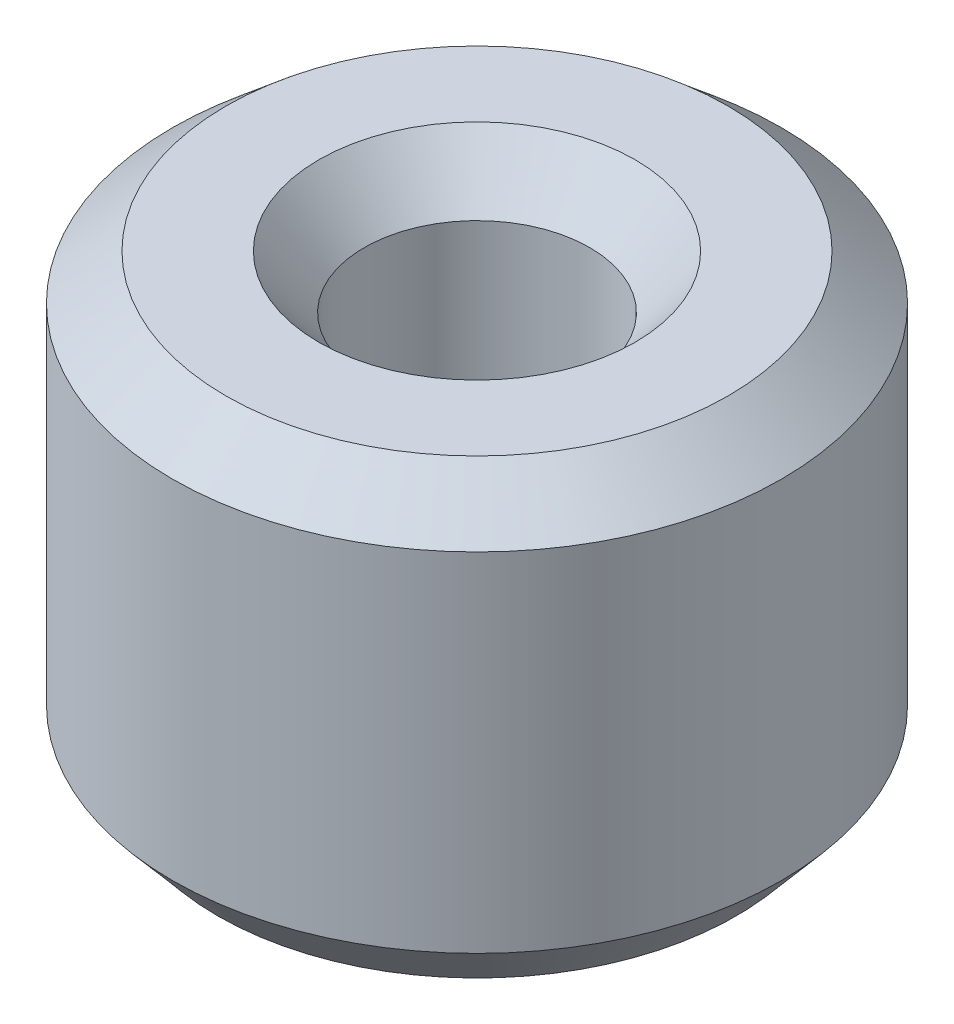
from build123d import *
from OCP.BRepFilletAPI import BRepFilletAPI_MakeChamfer

# Parameters (mm, degrees)
SKETCH1_R           = 12.5
BOSS_EXTRUDE1_DEPTH = 18.328211397
SKETCH2_R           = 4.629815426
CUT_EXTRUDE1_DEPTH  = 26.464157811
CHAMFER1_SIZE       = 1.862553043
CHAMFER1_SIZE2      = 2.192134217


with BuildPart() as part:
    # Sketch1 → Boss-Extrude1 (new body)
    with BuildSketch(Plane(origin=(0, 0, 0), x_dir=(1, 0, 0), z_dir=(0, 1, 0))):
        Circle(SKETCH1_R)
    extrude(amount=BOSS_EXTRUDE1_DEPTH)

    # Sketch2 → Cut-Extrude1 (cut, through all)
    with BuildSketch(Plane(origin=(0, 0, 0), x_dir=(1, 0, 0), z_dir=(0, 1, 0))):
        Circle(SKETCH2_R)
    extrude(amount=CUT_EXTRUDE1_DEPTH, mode=Mode.SUBTRACT)

    # Chamfer1: one chamfer whose edges measure the first distance from different faces: ONE call of the kernel's chamfer builder (chamfer() names one face for all edges)
    chamfer1_edges_1 = [part.edges().sort_by_distance(p)[0] for p in [
        (-4.629815426, 18.328211397, 0),
    ]]
    chamfer1_side_1 = [part.faces().sort_by_distance(p)[0] for p in [
        (-12.146446609, 18.328211397, 0),
    ]]
    chamfer1_edges_2 = [part.edges().sort_by_distance(p)[0] for p in [
        (-4.629815426, 0, 0),
    ]]
    chamfer1_side_2 = [part.faces().sort_by_distance(p)[0] for p in [
        (-4.629815426, 9.164105698, 0),
    ]]
    chamfer1_edges_3 = [part.edges().sort_by_distance(p)[0] for p in [
        (-12.5, 0, 0),
    ]]
    chamfer1_side_3 = [part.faces().sort_by_distance(p)[0] for p in [
        (-12.146446609, 0, 0),
    ]]
    chamfer1_edges_4 = [part.edges().sort_by_distance(p)[0] for p in [
        (-12.5, 18.328211397, 0),
    ]]
    chamfer1_side_4 = [part.faces().sort_by_distance(p)[0] for p in [
        (-12.5, 9.164105698, 0),
    ]]
    chamfer1 = BRepFilletAPI_MakeChamfer(part.part.solid().wrapped)
    for e in chamfer1_edges_1:
        chamfer1.Add(CHAMFER1_SIZE, CHAMFER1_SIZE2, e.wrapped, chamfer1_side_1[0].wrapped)  # the first distance lies on this face
    for e in chamfer1_edges_2:
        chamfer1.Add(CHAMFER1_SIZE, CHAMFER1_SIZE2, e.wrapped, chamfer1_side_2[0].wrapped)  # the first distance lies on this face
    for e in chamfer1_edges_3:
        chamfer1.Add(CHAMFER1_SIZE, CHAMFER1_SIZE2, e.wrapped, chamfer1_side_3[0].wrapped)  # the first distance lies on this face
    for e in chamfer1_edges_4:
        chamfer1.Add(CHAMFER1_SIZE, CHAMFER1_SIZE2, e.wrapped, chamfer1_side_4[0].wrapped)  # the first distance lies on this face
    add(Compound.cast(chamfer1.Shape()), mode=Mode.REPLACE)


solid = part.part
